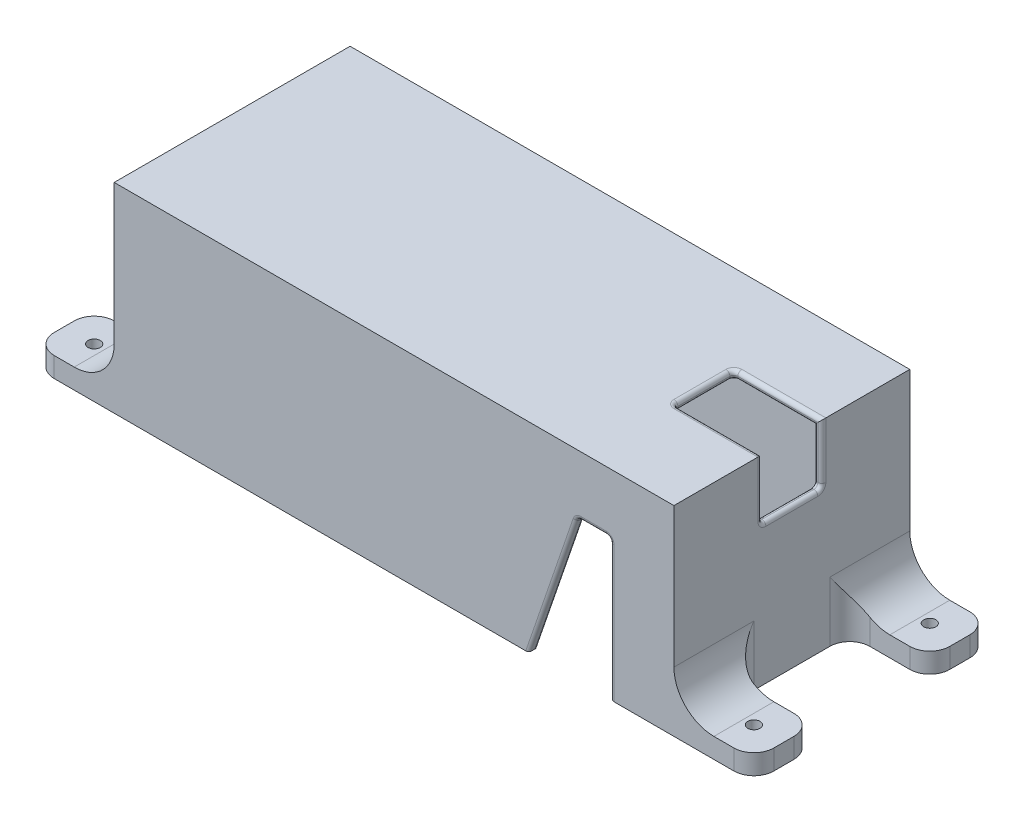
from build123d import *
from OCP.BRepFilletAPI import BRepFilletAPI_MakeFillet

# Parameters (mm, degrees)
SKETCH1_W               = 140
SKETCH1_H               = 59
BOSS_EXTRUDE1_DEPTH     = 50
SKETCH2_W               = 136
SKETCH2_H               = 55
CUT_EXTRUDE1_DEPTH      = 48
SKETCH3_W               = 20
SKETCH3_H               = 15
BOSS_EXTRUDE2_DEPTH     = 5
FILLET1_R1              = 5
FILLET1_R2              = 10
SKETCH4_5_R             = 4.45
BOSS_EXTRUDE3_DEPTH     = 1
CUT_EXTRUDE4_DEPTH      = 139.682525756
CUT_EXTRUDE4_DEPTH_BACK = 139.682525756
SKETCH4_R               = 1.525
SKETCH5_W               = 22
SKETCH5_H               = 15
ANTENNAHOLE_DEPTH       = 15
SKETCH6_R               = 4
SKETCH6_W               = 15
SKETCH6_H               = 16
CUT_EXTRUDE5_DEPTH      = 10
SKETCH7_W               = 37
SKETCH7_H               = 24
CUT_EXTRUDE6_DEPTH      = 10
CUT_EXTRUDE7_DEPTH      = 10
FILLET2_R               = 1


with BuildPart() as part:
    # Sketch1 → Boss-Extrude1 (new body)
    with BuildSketch(Plane(origin=(0, 0, 0), x_dir=(1, 0, 0), z_dir=(0, 1, 0))):
        with Locations((14.575342466, -46.636986301)):
            Rectangle(SKETCH1_W, SKETCH1_H)
    extrude(amount=BOSS_EXTRUDE1_DEPTH)

    # Sketch2 → Cut-Extrude1 (cut)
    with BuildSketch(Plane.XZ):
        with Locations((14.575342466, 46.636986301)):
            Rectangle(SKETCH2_W, SKETCH2_H)
    extrude(amount=-CUT_EXTRUDE1_DEPTH, mode=Mode.SUBTRACT)

    # Sketch3 → Boss-Extrude2 (add)
    with BuildSketch(Plane.XZ):
        with Locations((-65.424657534, 68.636986301)):
            Rectangle(SKETCH3_W, SKETCH3_H)
        with Locations((-65.424657534, 24.636986301)):
            Rectangle(SKETCH3_W, SKETCH3_H)
        with Locations((94.575342466, 24.636986301)):
            Rectangle(SKETCH3_W, SKETCH3_H)
        with Locations((94.575342466, 68.636986301)):
            Rectangle(SKETCH3_W, SKETCH3_H)
    extrude(amount=-BOSS_EXTRUDE2_DEPTH)

    # Fillet1: one fillet with a radius per group of edges: ONE call of the kernel's fillet builder (fillet() takes one radius for all edges)
    fillet1_edges_1 = [part.edges().sort_by_distance(p)[0] for p in [
        (84.575342466, 2.5, 61.136986301),
        (104.575342466, 2.5, 61.136986301),
        (104.575342466, 2.5, 32.136986301),
        (104.575342466, 2.5, 17.136986301),
        (104.575342466, 2.5, 76.136986301),
        (-55.424657534, 2.5, 61.136986301),
        (-75.424657534, 2.5, 61.136986301),
        (-75.424657534, 2.5, 76.136986301),
        (-75.424657534, 2.5, 32.136986301),
        (-55.424657534, 2.5, 32.136986301),
        (-75.424657534, 2.5, 17.136986301),
        (84.575342466, 2.5, 32.136986301),
    ]]
    fillet1_edges_2 = [part.edges().sort_by_distance(p)[0] for p in [
        (84.575342466, 5, 68.636986301),
        (84.575342466, 5, 24.636986301),
        (-55.424657534, 5, 68.636986301),
        (-55.424657534, 5, 24.636986301),
    ]]
    fillet1 = BRepFilletAPI_MakeFillet(part.part.solid().wrapped)
    for e in fillet1_edges_1:
        fillet1.Add(FILLET1_R1, e.wrapped)
    for e in fillet1_edges_2:
        fillet1.Add(FILLET1_R2, e.wrapped)
    add(Compound.cast(fillet1.Shape()), mode=Mode.REPLACE)

    # Sketch4<5> → Boss-Extrude3 (add)
    with BuildSketch(Plane(origin=(0, 0, 0), x_dir=(-1, 0, 0), z_dir=(0, -1, 0))):
        with Locations(Location((-97.075342466, -24.636986301, 0), (0, 0, 270))):
            Circle(SKETCH4_5_R)
    extrude(amount=BOSS_EXTRUDE3_DEPTH)

    # Sketch4 → Cut-Extrude4 (cut, two sides: drawn at the far end of the back side and taken through both)
    with BuildSketch(Plane(origin=(0, 0, 0), x_dir=(-1, 0, 0), z_dir=(0, -1, 0)).offset(-CUT_EXTRUDE4_DEPTH_BACK)):
        with Locations(Location((-97.075342466, -24.636986301, 0), (0, 0, 90))):
            Circle(SKETCH4_R)
        with Locations(Location((-97.075342466, -68.636986301, 0), (0, 0, 270))):
            Circle(SKETCH4_R)
        with Locations(Location((67.924657534, -68.636986301, 0), (0, 0, 90))):
            Circle(SKETCH4_R)
        with Locations(Location((67.924657534, -24.636986301, 0), (0, 0, 270))):
            Circle(SKETCH4_R)
    extrude(amount=CUT_EXTRUDE4_DEPTH + CUT_EXTRUDE4_DEPTH_BACK, mode=Mode.SUBTRACT)

    # Sketch5 → AntennaHole (cut)
    with BuildSketch(Plane(origin=(0, 50, 0), x_dir=(1, 0, 0), z_dir=(0, 1, 0))):
        with Locations((73.575342466, -46.636986301)):
            Rectangle(SKETCH5_W, SKETCH5_H)
    extrude(amount=-ANTENNAHOLE_DEPTH, mode=Mode.SUBTRACT)

    # Sketch6 → Cut-Extrude5 (cut)
    with BuildSketch(Plane.ZY.offset(55.424657534)):
        with Locations((59.136986301, 33)):
            Circle(SKETCH6_R)
        with Locations((29.136986301, 34)):
            Rectangle(SKETCH6_W, SKETCH6_H)
    extrude(amount=-CUT_EXTRUDE5_DEPTH, mode=Mode.SUBTRACT)

    # Sketch7 → Cut-Extrude6 (cut)
    with BuildSketch(Plane(origin=(0, 0, 17.136986301), x_dir=(-1, 0, 0), z_dir=(0, 0, -1))):
        with Locations((18.424657534, 25)):
            Rectangle(SKETCH7_W, SKETCH7_H)
    extrude(amount=-CUT_EXTRUDE6_DEPTH, mode=Mode.SUBTRACT)

    # Sketch8 → Cut-Extrude7 (cut)
    with BuildSketch(Plane.XY.offset(76.136986301)):
        Polygon((68.575342466, 35), (68.575342466, 0), (48.575342466, 0), (60.575342466, 35), align=None)
    extrude(amount=-CUT_EXTRUDE7_DEPTH, mode=Mode.SUBTRACT)

    # Fillet2
    fillet2_edges = [part.edges().sort_by_distance(p)[0] for p in [
        (72.575342466, 48, 39.136986301),
        (62.575342466, 48, 46.636986301),
        (72.575342466, 48, 54.136986301),
        (82.575342466, 35, 46.636986301),
        (82.575342466, 41.5, 54.136986301),
        (83.575342466, 35, 54.136986301),
        (84.575342466, 42.5, 54.136986301),
        (83.575342466, 35, 39.136986301),
        (82.575342466, 41.5, 39.136986301),
        (62.575342466, 49, 39.136986301),
        (62.575342466, 49, 54.136986301),
        (84.575342466, 35, 46.636986301),
        (84.575342466, 42.5, 39.136986301),
        (73.575342466, 50, 54.136986301),
        (73.575342466, 50, 39.136986301),
        (62.575342466, 50, 46.636986301),
        (-53.424657534, 34, 21.636986301),
        (-53.424657534, 26, 29.136986301),
        (-53.424657534, 34, 36.636986301),
        (-53.424657534, 42, 29.136986301),
        (-54.424657534, 42, 21.636986301),
        (-54.424657534, 42, 36.636986301),
        (-54.424657534, 26, 36.636986301),
        (-54.424657534, 26, 21.636986301),
        (-55.424657534, 42, 29.136986301),
        (-55.424657534, 34, 21.636986301),
        (-55.424657534, 26, 29.136986301),
        (-55.424657534, 34, 36.636986301),
        (-53.424657534, 33, 55.136986301),
        (-55.424657534, 33, 55.136986301),
        (0.075342466, 25, 19.136986301),
        (-18.424657534, 13, 19.136986301),
        (-36.924657534, 25, 19.136986301),
        (-18.424657534, 37, 19.136986301),
        (0.075342466, 37, 18.136986301),
        (-36.924657534, 37, 18.136986301),
        (-36.924657534, 13, 18.136986301),
        (0.075342466, 13, 18.136986301),
        (-18.424657534, 37, 17.136986301),
        (0.075342466, 25, 17.136986301),
        (-18.424657534, 13, 17.136986301),
        (-36.924657534, 25, 17.136986301),
        (54.575342466, 17.5, 74.136986301),
        (64.575342466, 35, 74.136986301),
        (68.575342466, 17.5, 74.136986301),
        (60.575342466, 35, 75.136986301),
        (68.575342466, 35, 75.136986301),
        (68.575342466, 0, 75.136986301),
        (48.575342466, 0, 75.136986301),
        (64.575342466, 35, 76.136986301),
        (54.575342466, 17.5, 76.136986301),
        (68.575342466, 17.5, 76.136986301),
    ]]
    fillet(fillet2_edges, radius=FILLET2_R - 0.0001)  # a hair under: the kernel refuses the full size


solid = part.part
